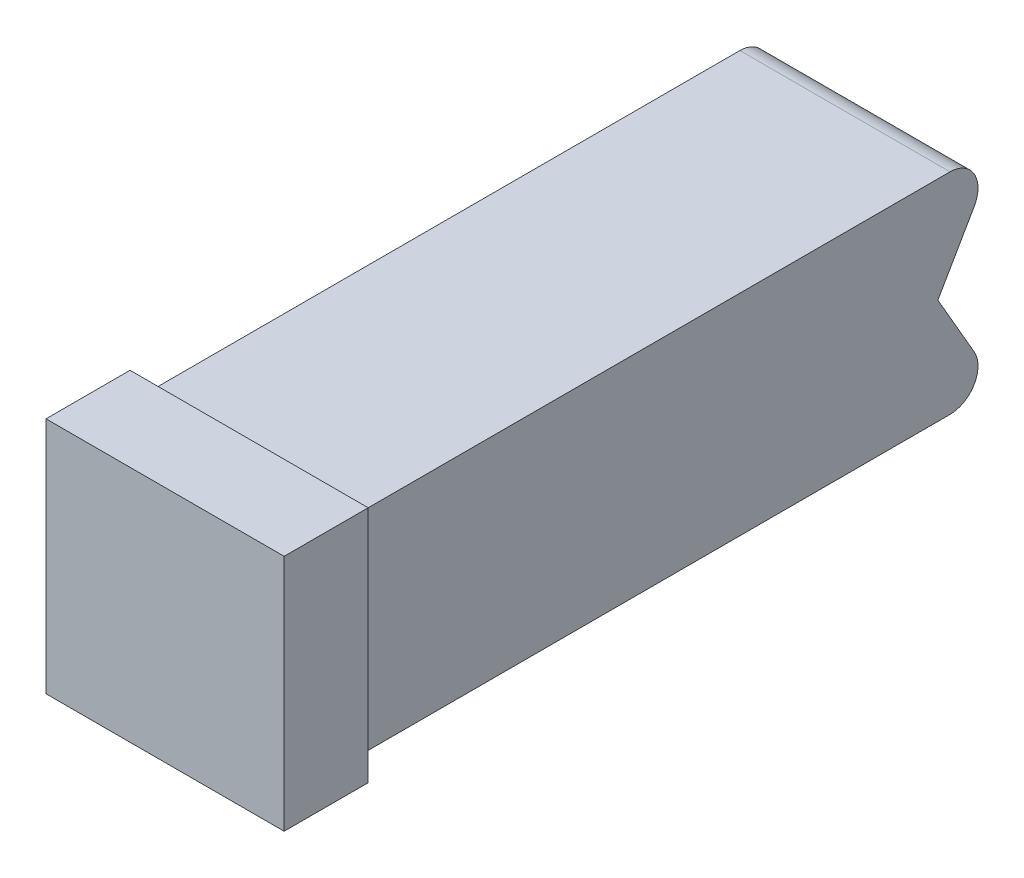
from build123d import *

# Parameters (mm, degrees)
BOSS_EXTRUDE1_START   = -0.5
BOSS_EXTRUDE1_DEPTH   = 8
BOSS_EXTRUDE1_2_DEPTH = 7.5
CUT_EXTRUDE1_DEPTH    = 0.5
SKETCH3_W             = 8
SKETCH3_H             = 24.267949192
BOSS_EXTRUDE2_DEPTH   = 0.5
CUT_EXTRUDE2_DEPTH    = 7.5
CUT_EXTRUDE3_DEPTH    = 0.433012702
CUT_EXTRUDE4_DEPTH    = 20.834936491
SKETCH7_W             = 3
SKETCH7_H             = 8.5
BOSS_EXTRUDE3_DEPTH   = 0.5


with BuildPart() as part:
    # Boss-Extrude1: read off the stored shape, not the designer's step
    # Boss-Extrude1 outline → Boss-Extrude1 (new body)
    with BuildSketch(Plane.ZY.offset(-8).offset(BOSS_EXTRUDE1_START)):
        with BuildLine():
            Line((-21.267949192, 8.5), (-21.267949192, 3.5))
            Line((-21.267949192, 3.5), (-22.133974596, 2))
            ThreePointArc((-22.133974596, 2), (-22.133974596, 1), (-21.267949192, 0.5))
            Line((-21.267949192, 0.5), (3, 0.5))
            Line((3, 0.5), (3, 8.5))
            Line((3, 8.5), (-21.267949192, 8.5))
        make_face()
    extrude(amount=BOSS_EXTRUDE1_DEPTH)

    # Boss-Extrude1 2 outline → Boss-Extrude1 2 (add)
    with BuildSketch(Plane.ZY.offset(-8)):
        with BuildLine():
            Line((-22.133974596, 6.5), (-21.267949192, 5))
            Line((-21.267949192, 5), (-21.267949192, 8))
            ThreePointArc((-21.267949192, 8), (-22.133974596, 7.5), (-22.133974596, 6.5))
        make_face()
    extrude(amount=BOSS_EXTRUDE1_2_DEPTH)

    # Sketch2 → Cut-Extrude1 (cut)
    with BuildSketch(Plane(origin=(8.5, 0, 0), x_dir=(0, 0, -1), z_dir=(1, 0, 0))):
        with BuildLine():
            Line((22.133974596, 2), (21.267949192, 3.5))
            Line((21.267949192, 3.5), (21.267949192, 0.5))
            ThreePointArc((21.267949192, 0.5), (22.133974596, 1), (22.133974596, 2))
        make_face()
    extrude(amount=-CUT_EXTRUDE1_DEPTH, mode=Mode.SUBTRACT)

    # Sketch3 → Boss-Extrude2 (add)
    with BuildSketch(Plane.XZ.offset(-0.5)):
        with Locations((4.5, -9.133974596)):
            Rectangle(SKETCH3_W, SKETCH3_H)
    extrude(amount=BOSS_EXTRUDE2_DEPTH)

    # Sketch4 → Cut-Extrude2 (cut)
    with BuildSketch(Plane.ZY.offset(-0.5)):
        Polygon((-21.267949192, 3.5), (-20.834936491, 4.25), (-21.267949192, 5), align=None)
    extrude(amount=-CUT_EXTRUDE2_DEPTH, mode=Mode.SUBTRACT)

    # Sketch5 → Cut-Extrude3 (cut)
    with BuildSketch(Plane(origin=(0, 0, -21.267949192), x_dir=(-1, 0, 0), z_dir=(0, 0, -1))):
        Polygon((-0.5, 8), (-0.5, 8.5), (-8.5, 8.5), (-8.5, 0), (-0.5, 0), (-0.5, 0.5), (-8, 0.5), (-8, 4.25), (-8, 8), align=None)
    extrude(amount=-CUT_EXTRUDE3_DEPTH, mode=Mode.SUBTRACT)

    # Sketch6 → Cut-Extrude4 (cut)
    with BuildSketch(Plane(origin=(0, 0, -20.834936491), x_dir=(-1, 0, 0), z_dir=(0, 0, -1))):
        Polygon((-0.5, 8), (-0.5, 8.5), (-8.5, 8.5), (-8.5, 0), (-0.5, 0), (-0.5, 0.5), (-8, 0.5), (-8, 8), align=None)
    extrude(amount=-CUT_EXTRUDE4_DEPTH, mode=Mode.SUBTRACT)

    # Sketch7 → Boss-Extrude3 (add)
    with BuildSketch(Plane.ZY.offset(-0.5)):
        with Locations((1.5, 4.25)):
            Rectangle(SKETCH7_W, SKETCH7_H)
    extrude(amount=BOSS_EXTRUDE3_DEPTH)


solid = part.part
